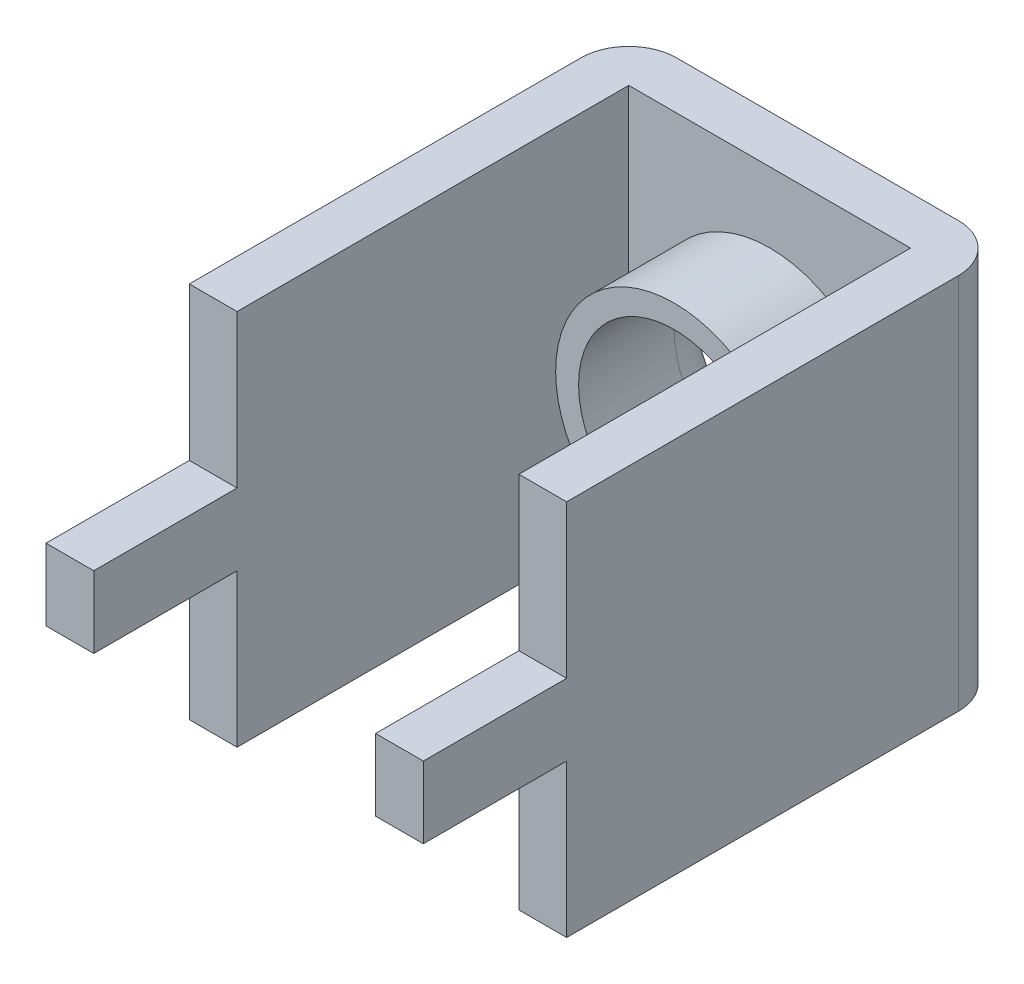
from build123d import *

# Parameters (mm, degrees)
SKETCH_1_W      = 7.9
SKETCH_1_H      = 7.9
SKETCH_1_R      = 2
EXTRUDE_1_DEPTH = 1
SKETCH_2_W      = 1
SKETCH_2_H      = 7.9
EXTRUDE_2_DEPTH = 9.2
SKETCH_3_W      = 1
SKETCH_3_H      = 1.5
EXTRUDE_3_DEPTH = 3
SKETCH_4_R      = 2.480212027
SKETCH_4_R_2    = 2
EXTRUDE_4_DEPTH = 2
FILLET_2_R      = 1


with BuildPart() as part:
    # 草图1 → 凸台-拉伸1 (new body)
    with BuildSketch(Plane.XY):
        Rectangle(SKETCH_1_W, SKETCH_1_H)
        Circle(SKETCH_1_R, mode=Mode.SUBTRACT)
    extrude(amount=EXTRUDE_1_DEPTH)

    # 草图2 → 凸台-拉伸2 (add)
    with BuildSketch(Plane.XY):
        with Locations((-3.45, 0)):
            Rectangle(SKETCH_2_W, SKETCH_2_H)
        with Locations((3.45, 0)):
            Rectangle(SKETCH_2_W, SKETCH_2_H)
    extrude(amount=EXTRUDE_2_DEPTH)

    # 草图3 → 凸台-拉伸3 (add)
    with BuildSketch(Plane.XY.offset(9.2)):
        with Locations((-3.45, 0)):
            Rectangle(SKETCH_3_W, SKETCH_3_H)
        with Locations((3.45, 0)):
            Rectangle(SKETCH_3_W, SKETCH_3_H)
    extrude(amount=EXTRUDE_3_DEPTH)

    # 草图4 → 凸台-拉伸4 (add)
    with BuildSketch(Plane.XY.offset(1)):
        with Locations(Location((0, 0, 0), (0, 0, 180))):
            Circle(SKETCH_4_R)
        Circle(SKETCH_4_R_2, mode=Mode.SUBTRACT)
    extrude(amount=EXTRUDE_4_DEPTH)

    # 圆角2
    # the kernel refuses this fillet: 1 mm, written as the material it takes off along each edge
    with BuildSketch(Plane(origin=(0, 0, 0), x_dir=(1, 0, 0), z_dir=(0, -1, 0))) as fillet_2_piece_1:
        with BuildLine():
            CenterArc((2 + FILLET_2_R, FILLET_2_R), FILLET_2_R, 180, 90)
            Line((2 + FILLET_2_R, 0), (2, 0))
            Line((2, 0), (2, FILLET_2_R))
        make_face()
    revolve(axis=Axis((0, 0, 0), (0, 0, 1)), mode=Mode.SUBTRACT)
    with BuildSketch(Plane(origin=(-3.95, 6.45, 0), x_dir=(0, 0, 1), z_dir=(0, -1, 0)), Plane(origin=(3.95, -6.45, 0), x_dir=(0, 0, 1), z_dir=(0, 1, 0))) as fillet_2_piece_2:
        with BuildLine():
            CenterArc((FILLET_2_R, -FILLET_2_R), FILLET_2_R, 90, 90)
            Line((0, -FILLET_2_R), (0, 0))
            Line((0, 0), (FILLET_2_R, 0))
        make_face()
    extrude(amount=12.9, mode=Mode.SUBTRACT)


solid = part.part
